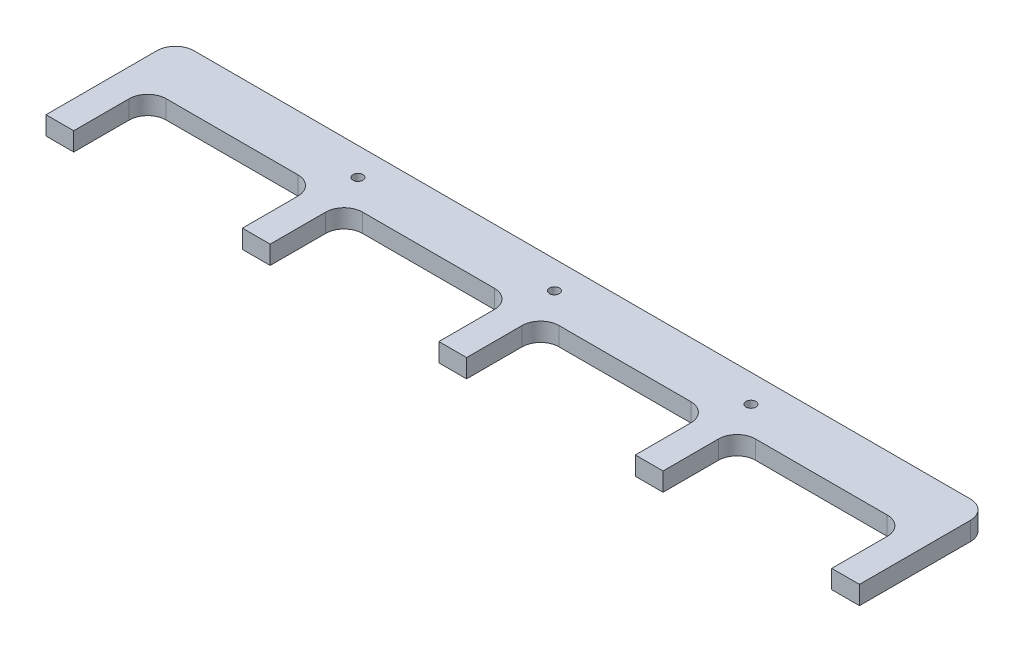
from build123d import *

# Parameters (mm, degrees)
SKETCH1_R           = 1.7
BOSS_EXTRUDE1_DEPTH = 6.35


with BuildPart() as part:
    # Sketch1 → Boss-Extrude1 (new body)
    with BuildSketch(Plane(origin=(0, 0, 0), x_dir=(1, 0, 0), z_dir=(0, 1, 0))):
        with BuildLine():
            Line((-139.7, 82.55), (-139.7, 44.45))
            Line((-139.7, 44.45), (-130.175, 44.45))
            Line((-130.175, 44.45), (-130.175, 63.5))
            ThreePointArc((-130.175, 63.5), (-128.315128061, 67.990128061), (-123.825, 69.85))
            Line((-123.825, 69.85), (-78.58125, 69.85))
            ThreePointArc((-78.58125, 69.85), (-74.091121939, 67.990128061), (-72.23125, 63.5))
            Line((-72.23125, 63.5), (-72.23125, 44.45))
            Line((-72.23125, 44.45), (-62.70625, 44.45))
            Line((-62.70625, 44.45), (-62.70625, 63.5))
            ThreePointArc((-62.70625, 63.5), (-60.846378061, 67.990128061), (-56.35625, 69.85))
            Line((-56.35625, 69.85), (-11.1125, 69.85))
            ThreePointArc((-11.1125, 69.85), (-6.622371939, 67.990128061), (-4.7625, 63.5))
            Line((-4.7625, 63.5), (-4.7625, 44.45))
            Line((-4.7625, 44.45), (4.7625, 44.45))
            Line((4.7625, 44.45), (4.7625, 63.5))
            ThreePointArc((4.7625, 63.5), (6.622371939, 67.990128061), (11.1125, 69.85))
            Line((11.1125, 69.85), (56.35625, 69.85))
            ThreePointArc((56.35625, 69.85), (60.846378061, 67.990128061), (62.70625, 63.5))
            Line((62.70625, 63.5), (62.70625, 44.45))
            Line((62.70625, 44.45), (72.23125, 44.45))
            Line((72.23125, 44.45), (72.23125, 63.5))
            ThreePointArc((72.23125, 63.5), (74.091121939, 67.990128061), (78.58125, 69.85))
            Line((78.58125, 69.85), (123.825, 69.85))
            ThreePointArc((123.825, 69.85), (128.315128061, 67.990128061), (130.175, 63.5))
            Line((130.175, 63.5), (130.175, 44.45))
            Line((130.175, 44.45), (139.7, 44.45))
            Line((139.7, 44.45), (139.7, 82.55))
            ThreePointArc((139.7, 82.55), (137.840128061, 87.040128061), (133.35, 88.9))
            Line((133.35, 88.9), (-133.35, 88.9))
            ThreePointArc((-133.35, 88.9), (-137.840128061, 87.040128061), (-139.7, 82.55))
        make_face()
        with Locations((-67.46875, 79.375)):
            Circle(SKETCH1_R, mode=Mode.SUBTRACT)
        with Locations((0, 79.375)):
            Circle(SKETCH1_R, mode=Mode.SUBTRACT)
        with Locations((67.46875, 79.375)):
            Circle(SKETCH1_R, mode=Mode.SUBTRACT)
    extrude(amount=BOSS_EXTRUDE1_DEPTH)


solid = part.part
